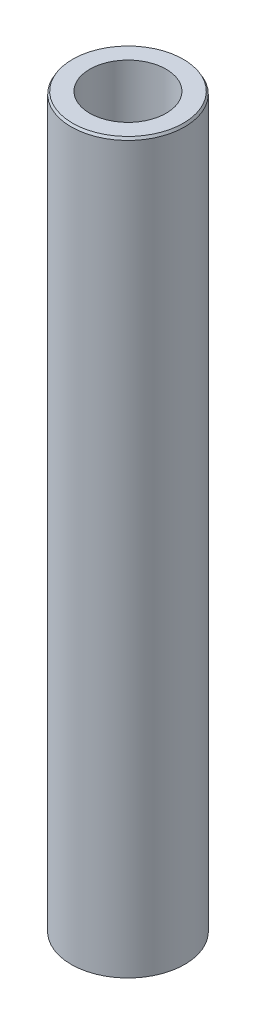
from build123d import *
from OCP.BRepFilletAPI import BRepFilletAPI_MakeChamfer

# Parameters (mm, degrees)
SKETCH1_R           = 27.5
BOSS_EXTRUDE1_DEPTH = 352.946405205
SKETCH2_R           = 18.486296977
CUT_EXTRUDE1_DEPTH  = 356.082617073
CHAMFER1_SIZE       = 1.192432762
CHAMFER1_SIZE2      = 0.688451376


with BuildPart() as part:
    # Sketch1 → Boss-Extrude1 (new body)
    with BuildSketch(Plane(origin=(0, 0, 0), x_dir=(1, 0, 0), z_dir=(0, 1, 0))):
        Circle(SKETCH1_R)
    extrude(amount=BOSS_EXTRUDE1_DEPTH)

    # Sketch2 → Cut-Extrude1 (cut, through all)
    with BuildSketch(Plane(origin=(0, 0, 0), x_dir=(1, 0, 0), z_dir=(0, 1, 0))):
        Circle(SKETCH2_R)
    extrude(amount=CUT_EXTRUDE1_DEPTH, mode=Mode.SUBTRACT)

    # Chamfer1: one chamfer whose edges measure the first distance from different faces: ONE call of the kernel's chamfer builder (chamfer() names one face for all edges)
    chamfer1_edges_1 = [part.edges().sort_by_distance(p)[0] for p in [
        (-27.5, 352.946405205, 0),
    ]]
    chamfer1_side_1 = [part.faces().sort_by_distance(p)[0] for p in [
        (-27.5, 176.473202603, 0),
    ]]
    chamfer1_edges_2 = [part.edges().sort_by_distance(p)[0] for p in [
        (-27.5, 0, 0),
    ]]
    chamfer1_side_2 = [part.faces().sort_by_distance(p)[0] for p in [
        (-26.722182541, 0, 0),
    ]]
    chamfer1 = BRepFilletAPI_MakeChamfer(part.part.solid().wrapped)
    for e in chamfer1_edges_1:
        chamfer1.Add(CHAMFER1_SIZE, CHAMFER1_SIZE2, e.wrapped, chamfer1_side_1[0].wrapped)  # the first distance lies on this face
    for e in chamfer1_edges_2:
        chamfer1.Add(CHAMFER1_SIZE, CHAMFER1_SIZE2, e.wrapped, chamfer1_side_2[0].wrapped)  # the first distance lies on this face
    add(Compound.cast(chamfer1.Shape()), mode=Mode.REPLACE)


solid = part.part
